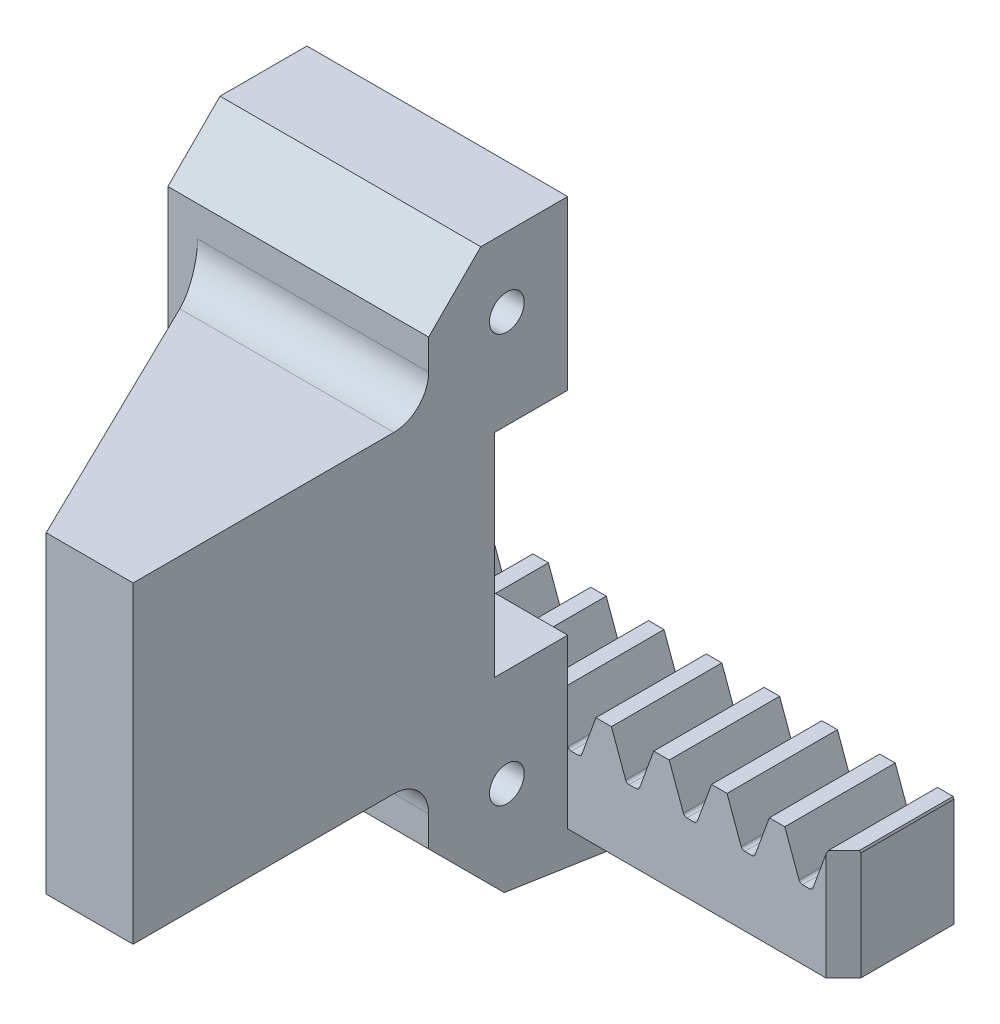
from build123d import *

# Parameters (mm, degrees)
BOSS_EXTRUDE1_START       = -15.249880268
BOSS_EXTRUDE1_DEPTH       = 15.861
BOSS_EXTRUDE1_START_2     = -4
BOSS_EXTRUDE1_2_DEPTH     = 16
BOSS_EXTRUDE1_START_3     = 3.175
BOSS_EXTRUDE1_3_DEPTH     = 8.825
BOSS_EXTRUDE1_START_4     = -2.731818182
BOSS_EXTRUDE1_4_DEPTH     = 4.906818182
BOSS_EXTRUDE1_START_5     = -5.890415993
BOSS_EXTRUDE1_5_DEPTH     = 9.065415993
BOSS_EXTRUDE1_START_6     = -5.975
BOSS_EXTRUDE1_6_DEPTH     = 8.072424826
CUT_EXTRUDE1_DEPTH        = 0.896206897
BOSS_EXTRUDE2_DEPTH       = 0.896206897
BOSS_EXTRUDE3_DEPTH       = 0.808533663
CUT_EXTRUDE2_DEPTH        = 5.906818182
CUT_EXTRUDE3_DEPTH        = 2.8
CUT_EXTRUDE4_DEPTH        = 13.2367
BOSS_EXTRUDE4_DEPTH       = 3.691466337
CUT_EXTRUDE5_DEPTH        = 1.013180268
BOSS_EXTRUDE5_DEPTH       = 6
BOSS_EXTRUDE6_DEPTH       = 4.5
CUT_EXTRUDE6_DEPTH        = 0.611119732
BOSS_EXTRUDE7_START       = 0.443181818
BOSS_EXTRUDE7_DEPTH       = 0.443181818
BOSS_EXTRUDE8_REACH       = 36.333
CUT_EXTRUDE7_DEPTH        = 6.35
CUT_EXTRUDE8_DEPTH        = 6.35
CUT_EXTRUDE9_DEPTH        = 6.35
CUT_EXTRUDE10_DEPTH       = 6.35
CUT_EXTRUDE11_DEPTH       = 6.35
CUT_EXTRUDE12_DEPTH       = 41.809385627
CUT_EXTRUDE13_DEPTH       = 41.809385627
CUT_EXTRUDE14_DEPTH       = 41.809385627
SKETCH24_W                = 4.2
SKETCH24_H                = 12.2
CUT_EXTRUDE15_DEPTH       = 43.984969129
F_3_CLEARANCE_HOLE1_D     = 2
F_3_CLEARANCE_HOLE1_DEPTH = 30.861103078


with BuildPart() as part:
    # Boss-Extrude1: read off the stored shape, not the designer's step
    # Boss-Extrude1 outline → Boss-Extrude1 (new body)
    with BuildSketch(Plane.ZY.offset(-0.180619732).offset(BOSS_EXTRUDE1_START)):
        Polygon((-2.731818182, -5.975), (6.825, -4.525), (11.175, -0.175), (11.175, 25.325), (8.175, 28.325), (-2.731818182, 28.325), (-2.731818182, 3.175), align=None)
    extrude(amount=BOSS_EXTRUDE1_DEPTH)

    # Boss-Extrude1 2 outline → Boss-Extrude1 2 (cut)
    with BuildSketch(Plane.XY.offset(BOSS_EXTRUDE1_START_2)):
        Polygon((14.4305, 3.175), (15.385266337, 3.175), (15.4305, 3.050721534), (15.4305, 28.325), (14.4305, 28.325), align=None)
    extrude(amount=BOSS_EXTRUDE1_2_DEPTH, mode=Mode.SUBTRACT)

    # Boss-Extrude1 3 outline → Boss-Extrude1 3 (cut)
    with BuildSketch(Plane.XY.offset(BOSS_EXTRUDE1_START_3)):
        Polygon((15.4305, 3.050721534), (15.385266337, 3.175), (14.4305, 3.175), (14.4305, -5.975), (15.4305, -5.975), align=None)
    extrude(amount=BOSS_EXTRUDE1_3_DEPTH, mode=Mode.SUBTRACT)

    # Boss-Extrude1 4 outline → Boss-Extrude1 4 (add)
    with BuildSketch(Plane.XY.offset(BOSS_EXTRUDE1_START_4)):
        Polygon((15.4305, 3.050721534), (15.385266337, 3.175), (14.4305, 3.175), (14.4305, -5.975), (15.4305, -5.975), align=None)
    extrude(amount=BOSS_EXTRUDE1_4_DEPTH)

    # Boss-Extrude1 5 outline → Boss-Extrude1 5 (cut)
    with BuildSketch(Plane(origin=(0, 0, 0), x_dir=(1, 0, 0), z_dir=(0, 1, 0)).offset(BOSS_EXTRUDE1_START_5)):
        Polygon((15.4305, -2.175), (14.4305, -3.175), (15.4305, -3.175), align=None)
    extrude(amount=BOSS_EXTRUDE1_5_DEPTH, mode=Mode.SUBTRACT)

    # Boss-Extrude1 6 outline → Boss-Extrude1 6 (add)
    with BuildSketch(Plane(origin=(0, 0, 0), x_dir=(1, 0, 0), z_dir=(0, 1, 0)).offset(BOSS_EXTRUDE1_START_6)):
        Polygon((14.4305, -2.175), (14.4305, -3.175), (15.4305, -2.175), align=None)
    extrude(amount=BOSS_EXTRUDE1_6_DEPTH)

    # Sketch2 → Cut-Extrude1 (cut)
    with BuildSketch(Plane.XZ.offset(5.975)):
        Polygon((15.4305, 2.175), (14.4305, 3.175), (14.4305, -2.731818182), (15.4305, -2.731818182), align=None)
    extrude(amount=-CUT_EXTRUDE1_DEPTH, mode=Mode.SUBTRACT)

    # Sketch3 → Boss-Extrude2 (add)
    with BuildSketch(Plane.XZ.offset(5.078793103)):
        Polygon((14.4305, 3.175), (15.4305, 2.175), (15.4305, -2.731818182), (14.4305, -2.731818182), align=None)
    extrude(amount=BOSS_EXTRUDE2_DEPTH)

    # Sketch4 → Boss-Extrude3 (add)
    with BuildSketch(Plane.ZY.offset(0.4305)):
        Polygon((-2.731818182, -5.975), (-2.731818182, 28.325), (8.175, 28.325), (11.175, 25.325), (11.175, -0.175), (6.825, -4.525), align=None)
    extrude(amount=BOSS_EXTRUDE3_DEPTH)

    # Sketch5 → Cut-Extrude2 (cut)
    with BuildSketch(Plane(origin=(0, 0, -2.731818182), x_dir=(-1, 0, 0), z_dir=(0, 0, -1))):
        with BuildLine():
            Line((1.239033663, 3.175), (1.239033663, 28.325))
            Line((1.239033663, 28.325), (-14.4305, 28.325))
            Line((-14.4305, 28.325), (-14.4305, 3.175))
            Line((-14.4305, 3.175), (-1.1938, 3.175))
            Line((-1.1938, 3.175), (-0.37822757, 0.934233164))
            ThreePointArc((-0.37822757, 0.934233164), (-0.301237046, 0.83389716), (-0.180619732, 0.795866667))
            Line((-0.180619732, 0.795866667), (0.225853395, 0.795866667))
            ThreePointArc((0.225853395, 0.795866667), (0.346470708, 0.83389716), (0.423461232, 0.934233164))
            Line((0.423461232, 0.934233164), (1.239033663, 3.175))
        make_face()
    extrude(amount=-CUT_EXTRUDE2_DEPTH, mode=Mode.SUBTRACT)

    # Sketch6 → Cut-Extrude3 (cut)
    with BuildSketch(Plane.XZ.offset(5.975)):
        Polygon((15.4305, 2.175), (14.4305, 3.175), (14.4305, -2.731818182), (15.4305, -2.731818182), align=None)
    extrude(amount=-CUT_EXTRUDE3_DEPTH, mode=Mode.SUBTRACT)

    # Sketch7 → Cut-Extrude4 (cut)
    with BuildSketch(Plane(origin=(14.4305, 0, 0), x_dir=(0, 0, -1), z_dir=(1, 0, 0))):
        Polygon((2.731818182, -5.975), (2.731818182, -3.175), (-3.175, -3.175), (-3.175, 3.175), (-3.175, 28.325), (-8.175, 28.325), (-11.175, 25.325), (-11.175, -0.175), (-6.825, -4.525), align=None)
    extrude(amount=-CUT_EXTRUDE4_DEPTH, mode=Mode.SUBTRACT)

    # Sketch8 → Boss-Extrude4 (add)
    with BuildSketch(Plane.ZY.offset(1.239033663)):
        Polygon((-2.731818182, -5.975), (-2.731818182, 3.175), (3.175, 3.175), (3.175, 28.325), (8.175, 28.325), (11.175, 25.325), (11.175, -0.175), (6.825, -4.525), align=None)
    extrude(amount=BOSS_EXTRUDE4_DEPTH)

    # Sketch9 → Cut-Extrude5 (cut)
    with BuildSketch(Plane(origin=(1.1938, 0, 0), x_dir=(0, 0, -1), z_dir=(1, 0, 0))):
        Polygon((2.731818182, -5.975), (2.731818182, -3.175), (-3.175, -3.175), (-3.175, 0.795866667), (-3.175, 28.325), (-8.175, 28.325), (-11.175, 25.325), (-11.175, -0.175), (-6.825, -4.525), align=None)
    extrude(amount=-CUT_EXTRUDE5_DEPTH, mode=Mode.SUBTRACT)

    # Sketch10 → Boss-Extrude5 (add)
    with BuildSketch(Plane.ZY.offset(4.9305)):
        Polygon((10.375, -0.975), (-2.731818182, -0.975), (-2.731818182, 3.175), (3.175, 3.175), (3.175, 28.325), (8.175, 28.325), (11.175, 25.325), (11.175, -0.175), align=None)
    extrude(amount=BOSS_EXTRUDE5_DEPTH)

    # Sketch11 → Boss-Extrude6 (add)
    with BuildSketch(Plane.ZY.offset(10.9305)):
        Polygon((-2.731818182, 3.175), (3.175, 3.175), (3.175, 28.325), (8.175, 28.325), (11.175, 25.325), (11.175, -0.175), (6.825, -4.525), (-2.731818182, -5.975), align=None)
    extrude(amount=BOSS_EXTRUDE6_DEPTH)

    # Sketch12 → Cut-Extrude6 (cut)
    with BuildSketch(Plane(origin=(0.180619732, 0, 0), x_dir=(0, 0, -1), z_dir=(1, 0, 0))):
        Polygon((2.731818182, -5.975), (2.731818182, -3.175), (-3.175, -3.175), (-3.175, 0.953572019), (-3.175, 28.325), (-8.175, 28.325), (-11.175, 25.325), (-11.175, -0.175), (-6.825, -4.525), align=None)
    extrude(amount=-CUT_EXTRUDE6_DEPTH, mode=Mode.SUBTRACT)

    # Sketch13 → Boss-Extrude7 (add)
    with BuildSketch(Plane(origin=(0, 0, -2.731818182), x_dir=(-1, 0, 0), z_dir=(0, 0, -1)).offset(BOSS_EXTRUDE7_START)):
        with BuildLine():
            Line((-1.1938, 3.175), (-0.37822757, 0.934233164))
            ThreePointArc((-0.37822757, 0.934233164), (-0.301237046, 0.83389716), (-0.180619732, 0.795866667))
            Line((-0.180619732, 0.795866667), (0.225853395, 0.795866667))
            ThreePointArc((0.225853395, 0.795866667), (0.346470708, 0.83389716), (0.423461232, 0.934233164))
            Line((0.423461232, 0.934233164), (1.239033663, 3.175))
            Line((1.239033663, 3.175), (15.4305, 3.175))
            Line((15.4305, 3.175), (15.4305, -5.975))
            Line((15.4305, -5.975), (10.9305, -5.975))
            Line((10.9305, -5.975), (10.9305, -0.975))
            Line((10.9305, -0.975), (4.9305, -0.975))
            Line((4.9305, -0.975), (4.9305, -5.975))
            Line((4.9305, -5.975), (0.4305, -5.975))
            Line((0.4305, -5.975), (0.4305, -3.175))
            Line((0.4305, -3.175), (-15.4305, -3.175))
            Line((-15.4305, -3.175), (-15.4305, 3.050721534))
            Line((-15.4305, 3.050721534), (-15.385266337, 3.175))
            Line((-15.385266337, 3.175), (-1.1938, 3.175))
        make_face()
    extrude(amount=-BOSS_EXTRUDE7_DEPTH)

    # Boss-Extrude8: up to this plane
    boss_extrude8_end = Plane(origin=(-15.488026312, 0, 7.554015165), z_dir=(-0.8987940462991697, 0, 0.438371146789072))
    # Sketch15 → Boss-Extrude8 (add, up to the surface)
    with BuildSketch(Plane(origin=(-0.4305, 0, 0), x_dir=(0, 0, -1), z_dir=(1, 0, 0)), mode=Mode.PRIVATE) as boss_extrude8_sk1:
        with BuildLine():
            Line((-11.175, 1.575), (-11.175, 23.575))
            ThreePointArc((-11.175, 23.575), (-11.760786438, 22.160786438), (-13.175, 21.575))
            Line((-13.175, 21.575), (-28.175, 21.575))
            Line((-28.175, 21.575), (-28.175, 3.575))
            Line((-28.175, 3.575), (-13.175, 3.575))
            ThreePointArc((-13.175, 3.575), (-11.760786438, 2.989213562), (-11.175, 1.575))
        make_face()
    boss_extrude8_tool1 = split(extrude(boss_extrude8_sk1.sketch, amount=-BOSS_EXTRUDE8_REACH, mode=Mode.PRIVATE), bisect_by=boss_extrude8_end, keep=Keep.BOTH, mode=Mode.PRIVATE)
    add(boss_extrude8_tool1.solids().sort_by_distance((-0.4305, 12.575, 19.630069))[0])

    # Sketch16 → Cut-Extrude7 (cut)
    with BuildSketch(Plane(origin=(0, 0, -3.175), x_dir=(-1, 0, 0), z_dir=(0, 0, -1))):
        with BuildLine():
            Line((3.748321232, 0.934233164), (4.563893663, 3.175))
            Line((4.563893663, 3.175), (2.13106, 3.175))
            Line((2.13106, 3.175), (2.94663243, 0.934233164))
            ThreePointArc((2.94663243, 0.934233164), (3.023622954, 0.83389716), (3.144240268, 0.795866667))
            Line((3.144240268, 0.795866667), (3.550713395, 0.795866667))
            ThreePointArc((3.550713395, 0.795866667), (3.671330708, 0.83389716), (3.748321232, 0.934233164))
        make_face()
    extrude(amount=-CUT_EXTRUDE7_DEPTH, mode=Mode.SUBTRACT)

    # Sketch17 → Cut-Extrude8 (cut)
    with BuildSketch(Plane(origin=(0, 0, -3.175), x_dir=(-1, 0, 0), z_dir=(0, 0, -1))):
        with BuildLine():
            Line((7.073181232, 0.934233164), (7.888753663, 3.175))
            Line((7.888753663, 3.175), (5.45592, 3.175))
            Line((5.45592, 3.175), (6.27149243, 0.934233164))
            ThreePointArc((6.27149243, 0.934233164), (6.348482954, 0.83389716), (6.469100268, 0.795866667))
            Line((6.469100268, 0.795866667), (6.875573395, 0.795866667))
            ThreePointArc((6.875573395, 0.795866667), (6.996190708, 0.83389716), (7.073181232, 0.934233164))
        make_face()
    extrude(amount=-CUT_EXTRUDE8_DEPTH, mode=Mode.SUBTRACT)

    # Sketch18 → Cut-Extrude9 (cut)
    with BuildSketch(Plane(origin=(0, 0, -3.175), x_dir=(-1, 0, 0), z_dir=(0, 0, -1))):
        with BuildLine():
            Line((10.398041232, 0.934233164), (11.213613663, 3.175))
            Line((11.213613663, 3.175), (8.78078, 3.175))
            Line((8.78078, 3.175), (9.59635243, 0.934233164))
            ThreePointArc((9.59635243, 0.934233164), (9.673342954, 0.83389716), (9.793960268, 0.795866667))
            Line((9.793960268, 0.795866667), (10.200433395, 0.795866667))
            ThreePointArc((10.200433395, 0.795866667), (10.321050708, 0.83389716), (10.398041232, 0.934233164))
        make_face()
    extrude(amount=-CUT_EXTRUDE9_DEPTH, mode=Mode.SUBTRACT)

    # Sketch19 → Cut-Extrude10 (cut)
    with BuildSketch(Plane(origin=(0, 0, -3.175), x_dir=(-1, 0, 0), z_dir=(0, 0, -1))):
        with BuildLine():
            Line((13.722901232, 0.934233164), (14.538473663, 3.175))
            Line((14.538473663, 3.175), (12.10564, 3.175))
            Line((12.10564, 3.175), (12.92121243, 0.934233164))
            ThreePointArc((12.92121243, 0.934233164), (12.998202954, 0.83389716), (13.118820268, 0.795866667))
            Line((13.118820268, 0.795866667), (13.525293395, 0.795866667))
            ThreePointArc((13.525293395, 0.795866667), (13.645910708, 0.83389716), (13.722901232, 0.934233164))
        make_face()
    extrude(amount=-CUT_EXTRUDE10_DEPTH, mode=Mode.SUBTRACT)

    # Sketch20 → Cut-Extrude11 (cut)
    with BuildSketch(Plane(origin=(0, 0, -3.175), x_dir=(-1, 0, 0), z_dir=(0, 0, -1))):
        with BuildLine():
            Line((-12.060406337, 3.175), (-14.49324, 3.175))
            Line((-14.49324, 3.175), (-13.67766757, 0.934233164))
            ThreePointArc((-13.67766757, 0.934233164), (-13.600677046, 0.83389716), (-13.480059732, 0.795866667))
            Line((-13.480059732, 0.795866667), (-13.073586605, 0.795866667))
            ThreePointArc((-13.073586605, 0.795866667), (-12.952969292, 0.83389716), (-12.875978768, 0.934233164))
            Line((-12.875978768, 0.934233164), (-12.060406337, 3.175))
        make_face()
    extrude(amount=-CUT_EXTRUDE11_DEPTH, mode=Mode.SUBTRACT)

    # Sketch21 → Cut-Extrude12 (cut, through all)
    with BuildSketch(Plane.XY.offset(3.175)):
        with BuildLine():
            Line((2.085826337, 3.175), (2.901398768, 0.934233164))
            ThreePointArc((2.901398768, 0.934233164), (2.978389292, 0.83389716), (3.099006605, 0.795866667))
            Line((3.099006605, 0.795866667), (3.505479732, 0.795866667))
            ThreePointArc((3.505479732, 0.795866667), (3.626097046, 0.83389716), (3.70308757, 0.934233164))
            Line((3.70308757, 0.934233164), (4.51866, 3.175))
            Line((4.51866, 3.175), (2.085826337, 3.175))
        make_face()
    extrude(amount=-CUT_EXTRUDE12_DEPTH, mode=Mode.SUBTRACT)

    # Sketch22 → Cut-Extrude13 (cut, through all)
    with BuildSketch(Plane.XY.offset(3.175)):
        with BuildLine():
            Line((5.410686337, 3.175), (6.226258768, 0.934233164))
            ThreePointArc((6.226258768, 0.934233164), (6.303249292, 0.83389716), (6.423866605, 0.795866667))
            Line((6.423866605, 0.795866667), (6.830339732, 0.795866667))
            ThreePointArc((6.830339732, 0.795866667), (6.950957046, 0.83389716), (7.02794757, 0.934233164))
            Line((7.02794757, 0.934233164), (7.84352, 3.175))
            Line((7.84352, 3.175), (5.410686337, 3.175))
        make_face()
    extrude(amount=-CUT_EXTRUDE13_DEPTH, mode=Mode.SUBTRACT)

    # Sketch23 → Cut-Extrude14 (cut, through all)
    with BuildSketch(Plane.XY.offset(3.175)):
        with BuildLine():
            Line((8.735546337, 3.175), (9.551118768, 0.934233164))
            ThreePointArc((9.551118768, 0.934233164), (9.628109292, 0.83389716), (9.748726605, 0.795866667))
            Line((9.748726605, 0.795866667), (10.155199732, 0.795866667))
            ThreePointArc((10.155199732, 0.795866667), (10.275817046, 0.83389716), (10.35280757, 0.934233164))
            Line((10.35280757, 0.934233164), (11.16838, 3.175))
            Line((11.16838, 3.175), (8.735546337, 3.175))
        make_face()
    extrude(amount=-CUT_EXTRUDE14_DEPTH, mode=Mode.SUBTRACT)

    # Sketch24 → Cut-Extrude15 (cut, through all)
    with BuildSketch(Plane(origin=(-0.4305, 0, 0), x_dir=(0, 0, -1), z_dir=(1, 0, 0))):
        with Locations((-5.275, 12.575)):
            Rectangle(SKETCH24_W, SKETCH24_H)
    extrude(amount=-CUT_EXTRUDE15_DEPTH, mode=Mode.SUBTRACT)

    # #3 Clearance Hole1
    with Locations(Plane.ZY.offset(15.4305)):
        with Locations((6.675, 24.325), (6.675, 0.825)):
            Hole(F_3_CLEARANCE_HOLE1_D / 2, depth=F_3_CLEARANCE_HOLE1_DEPTH)


solid = part.part
